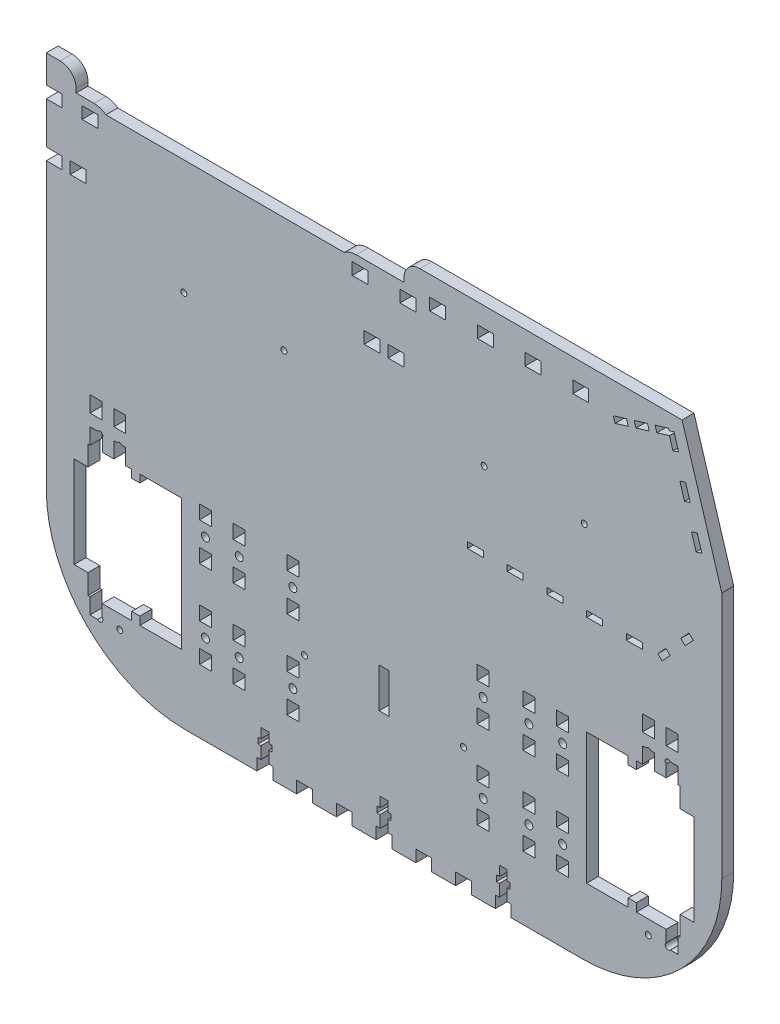
from build123d import *

# Parameters (mm, degrees)
ESQUISSE1_W              = 340
ESQUISSE1_H              = 260
BOSS_EXTRU_1_DEPTH       = 6
ESQUISSE10_R             = 2
ESQUISSE10_W             = 6
ESQUISSE10_H             = 7
ESQUISSE10_W_2           = 5
ESQUISSE10_H_2           = 20
ESQUISSE10_W_3           = 21
ESQUISSE10_H_3           = 66
ENL_V_MAT_EXTRU_5_DEPTH  = 6
ESQUISSE13_R             = 1.5
ENL_V_MAT_EXTRU_6_DEPTH  = 6
CONG_1_R                 = 70
ESQUISSE14_W             = 165
ESQUISSE14_H             = 10
ENL_V_MAT_EXTRU_7_DEPTH  = 10
ESQUISSE15_W             = 120
ESQUISSE15_H             = 2
ENL_V_MAT_EXTRU_8_DEPTH  = 10
CONG_2_R                 = 10
CONG_3_R                 = 8
ESQUISSE16_W             = 8
ESQUISSE16_H             = 6
ENL_V_MAT_EXTRU_9_DEPTH  = 10
ENL_V_MAT_EXTRU_10_DEPTH = 10
ESQUISSE18_W             = 8
ESQUISSE18_H             = 3
ENL_V_MAT_EXTRU_11_DEPTH = 6
ESQUISSE20_W             = 8
ESQUISSE20_H             = 6
ENL_V_MAT_EXTRU_12_DEPTH = 6
ENL_V_MAT_EXTRU_13_DEPTH = 6
ESQUISSE22_W             = 8
ESQUISSE22_H             = 6
ENL_V_MAT_EXTRU_14_DEPTH = 6
ESQUISSE25_W             = 6.118033989
ESQUISSE25_H             = 8
ESQUISSE25_W_2           = 6.235191658
ESQUISSE25_W_3           = 6
ENL_V_MAT_EXTRU_15_DEPTH = 10
ESQUISSE26_W             = 4
ESQUISSE26_H             = 14
ESQUISSE26_W_2           = 7
ESQUISSE26_H_2           = 3
ENL_V_MAT_EXTRU_16_DEPTH = 429.060743353


with BuildPart() as part:
    # Esquisse1 → Boss.-Extru.1 (new body)
    with BuildSketch(Plane.XY):
        with Locations((-170, 130)):
            Rectangle(ESQUISSE1_W, ESQUISSE1_H)
    extrude(amount=-BOSS_EXTRU_1_DEPTH)

    # Esquisse10 → Enlèv. mat.-Extru.5 (cut)
    with BuildSketch(Plane(origin=(0, 0, -6), x_dir=(-1, 0, 0), z_dir=(0, 0, -1))):
        with Locations((259.9, 45)):
            Circle(ESQUISSE10_R)
        with Locations((259.9, 89)):
            Circle(ESQUISSE10_R)
        with Locations((242.9, 45)):
            Circle(ESQUISSE10_R)
        with Locations((242.9, 89)):
            Circle(ESQUISSE10_R)
        with Locations((215.9, 45)):
            Circle(ESQUISSE10_R)
        with Locations((215.9, 89)):
            Circle(ESQUISSE10_R)
        with Locations(Location((97.1, 89, 0), (0, 0, 180))):
            Circle(ESQUISSE10_R)
        with Locations(Location((97.1, 45, 0), (0, 0, 180))):
            Circle(ESQUISSE10_R)
        with Locations(Location((80.1, 89, 0), (0, 0, 180))):
            Circle(ESQUISSE10_R)
        with Locations(Location((120.1, 89, 0), (0, 0, 180))):
            Circle(ESQUISSE10_R)
        with Locations(Location((120.1, 45, 0), (0, 0, 180))):
            Circle(ESQUISSE10_R)
        with Locations(Location((80.1, 45, 0), (0, 0, 180))):
            Circle(ESQUISSE10_R)
        with Locations((259.9, 35.5)):
            Rectangle(ESQUISSE10_W, ESQUISSE10_H)
        with Locations((259.9, 54.5)):
            Rectangle(ESQUISSE10_W, ESQUISSE10_H)
        with Locations((259.9, 79.5)):
            Rectangle(ESQUISSE10_W, ESQUISSE10_H)
        with Locations((259.9, 98.5)):
            Rectangle(ESQUISSE10_W, ESQUISSE10_H)
        with Locations((242.9, 35.5)):
            Rectangle(ESQUISSE10_W, ESQUISSE10_H)
        with Locations((170, 67)):
            Rectangle(ESQUISSE10_W_2, ESQUISSE10_H_2)
        with Locations((242.9, 54.5)):
            Rectangle(ESQUISSE10_W, ESQUISSE10_H)
        with Locations((242.9, 79.5)):
            Rectangle(ESQUISSE10_W, ESQUISSE10_H)
        with Locations((242.9, 98.5)):
            Rectangle(ESQUISSE10_W, ESQUISSE10_H)
        with Locations((215.9, 35.5)):
            Rectangle(ESQUISSE10_W, ESQUISSE10_H)
        with Locations((215.9, 54.5)):
            Rectangle(ESQUISSE10_W, ESQUISSE10_H)
        with Locations((215.9, 79.5)):
            Rectangle(ESQUISSE10_W, ESQUISSE10_H)
        with Locations((215.9, 98.5)):
            Rectangle(ESQUISSE10_W, ESQUISSE10_H)
        with Locations((97.1, 98.5)):
            Rectangle(ESQUISSE10_W, ESQUISSE10_H)
        with Locations((97.1, 79.5)):
            Rectangle(ESQUISSE10_W, ESQUISSE10_H)
        with Locations((97.1, 54.5)):
            Rectangle(ESQUISSE10_W, ESQUISSE10_H)
        with Locations((97.1, 35.5)):
            Rectangle(ESQUISSE10_W, ESQUISSE10_H)
        with Locations((80.1, 98.5)):
            Rectangle(ESQUISSE10_W, ESQUISSE10_H)
        with Locations((80.1, 79.5)):
            Rectangle(ESQUISSE10_W, ESQUISSE10_H)
        with Locations((120.1, 98.5)):
            Rectangle(ESQUISSE10_W, ESQUISSE10_H)
        with Locations((120.1, 79.5)):
            Rectangle(ESQUISSE10_W, ESQUISSE10_H)
        with Locations((80.1, 54.5)):
            Rectangle(ESQUISSE10_W, ESQUISSE10_H)
        with Locations((120.1, 54.5)):
            Rectangle(ESQUISSE10_W, ESQUISSE10_H)
        with Locations((120.1, 35.5)):
            Rectangle(ESQUISSE10_W, ESQUISSE10_H)
        with Locations((80.1, 35.5)):
            Rectangle(ESQUISSE10_W, ESQUISSE10_H)
        with Locations((282.4, 67)):
            Rectangle(ESQUISSE10_W_3, ESQUISSE10_H_3)
        with Locations((57.6, 67)):
            Rectangle(ESQUISSE10_W_3, ESQUISSE10_H_3)
    extrude(amount=-ENL_V_MAT_EXTRU_5_DEPTH, mode=Mode.SUBTRACT)

    # Esquisse13 → Enlèv. mat.-Extru.6 (cut)
    with BuildSketch(Plane(origin=(0, 0, -6), x_dir=(-1, 0, 0), z_dir=(0, 0, -1))):
        with Locations((69.249793531, 190.11516604)):
            Circle(ESQUISSE13_R)
        with Locations((119.624896765, 190.11516604)):
            Circle(ESQUISSE13_R)
        with Locations(Location((220.375103235, 190.11516604, 0), (0, 0, 180))):
            Circle(ESQUISSE13_R)
        with Locations(Location((270.750206469, 190.11516604, 0), (0, 0, 180))):
            Circle(ESQUISSE13_R)
        with Locations((27, 27)):
            Circle(ESQUISSE13_R)
        with Locations((130, 62.4)):
            Circle(ESQUISSE13_R)
        with Locations(Location((210, 62.4, 0), (0, 0, 180))):
            Circle(ESQUISSE13_R)
        with Locations((37, 27)):
            Circle(ESQUISSE13_R)
        with Locations(Location((37, 107.148940914, 0), (0, 0, 180))):
            Circle(ESQUISSE13_R)
        with Locations(Location((27, 107.148940914, 0), (0, 0, 180))):
            Circle(ESQUISSE13_R)
        with Locations(Location((303, 27, 0), (0, 0, 180))):
            Circle(ESQUISSE13_R)
        with Locations(Location((313, 27, 0), (0, 0, 180))):
            Circle(ESQUISSE13_R)
        with Locations((313, 107.148940914)):
            Circle(ESQUISSE13_R)
        with Locations((303, 107.148940914)):
            Circle(ESQUISSE13_R)
        Polygon((43, 100), (21, 100), (21, 90), (14, 90), (14, 44), (21, 44), (21, 34), (43, 34), (43, 38.074470457), (47.1, 38.074470457), (47.1, 96.074470457), (43, 96.074470457), align=None)
        Polygon((297, 38.074470457), (297, 34), (319, 34), (319, 44), (326, 44), (326, 90), (319, 90), (319, 100), (297, 100), (297, 96.074470457), (292.9, 96.074470457), (292.9, 38.074470457), align=None)
    extrude(amount=-ENL_V_MAT_EXTRU_6_DEPTH, mode=Mode.SUBTRACT)

    # Congé1
    cong_1_edges = [part.edges().sort_by_distance(p)[0] for p in [
        (0, 0, -3),
        (-340, 0, -3),
    ]]
    fillet(cong_1_edges, radius=CONG_1_R)

    # Esquisse14 → Enlèv. mat.-Extru.7 (cut)
    with BuildSketch(Plane(origin=(0, 0, -6), x_dir=(-1, 0, 0), z_dir=(0, 0, -1))):
        with Locations((242.5, 255)):
            Rectangle(ESQUISSE14_W, ESQUISSE14_H)
    extrude(amount=-ENL_V_MAT_EXTRU_7_DEPTH, mode=Mode.SUBTRACT)

    # Esquisse15 → Enlèv. mat.-Extru.8 (cut)
    with BuildSketch(Plane.XY):
        with Locations((-250, 249)):
            Rectangle(ESQUISSE15_W, ESQUISSE15_H)
    extrude(amount=-ENL_V_MAT_EXTRU_8_DEPTH, mode=Mode.SUBTRACT)

    # Congé2
    # the kernel refuses this fillet: 10 mm, written as the material it takes off along each edge
    with BuildSketch(Plane(origin=(-190, 250, 15), x_dir=(1, 0, 0), z_dir=(0, 0, -1))) as cong_2_piece_1:
        with BuildLine():
            CenterArc((6, 10), CONG_2_R, 233.130102354, 36.869897646)
            Line((0, 2), (-0.12, 1.84))
            ThreePointArc((-0.12, 1.84), (-0.2, 1), (-0.2, 0))
            Line((-0.2, 0), (0, -0.2))
            Line((0, -0.2), (6, -0.2))
            Line((6, -0.2), (6, 0))
        make_face()
    extrude(amount=36, mode=Mode.SUBTRACT)
    with BuildSketch(Plane(origin=(-310, 250, 15), x_dir=(0, -1, 0), z_dir=(0, 0, -1))) as cong_2_piece_2:
        with BuildLine():
            CenterArc((10, 6), CONG_2_R, 180, 36.869897646)
            Line((0, 6), (-0.2, 6))
            Line((-0.2, 6), (-0.2, 0))
            Line((-0.2, 0), (0, -0.2))
            ThreePointArc((0, -0.2), (1, -0.2), (1.84, -0.12))
            Line((1.84, -0.12), (2, 0))
        make_face()
    extrude(amount=36, mode=Mode.SUBTRACT)

    # Congé3
    cong_3_edges = [part.edges().sort_by_distance(p)[0] for p in [
        (-160, 260, -3),
        (-325, 260, -3),
    ]]
    fillet(cong_3_edges, radius=CONG_3_R)

    # Esquisse16 → Enlèv. mat.-Extru.9 (cut)
    with BuildSketch(Plane.XY):
        with Locations((-110, 3)):
            Rectangle(ESQUISSE16_W, ESQUISSE16_H)
        with Locations((-130, 3)):
            Rectangle(ESQUISSE16_W, ESQUISSE16_H)
        with Locations((-150, 3)):
            Rectangle(ESQUISSE16_W, ESQUISSE16_H)
        with Locations((-170, 3)):
            Rectangle(ESQUISSE16_W, ESQUISSE16_H)
        with Locations((-190, 3)):
            Rectangle(ESQUISSE16_W, ESQUISSE16_H)
        with Locations((-210, 3)):
            Rectangle(ESQUISSE16_W, ESQUISSE16_H)
        with Locations((-230, 3)):
            Rectangle(ESQUISSE16_W, ESQUISSE16_H)
    extrude(amount=-ENL_V_MAT_EXTRU_9_DEPTH, mode=Mode.SUBTRACT)

    # Esquisse17 → Enlèv. mat.-Extru.10 (cut)
    with BuildSketch(Plane.XY):
        Polygon((0, 260), (-20, 260), (-18.336052348, 254.557472466), (-15.997078711, 246.907034419), (-12.488618254, 235.431377347), (-10.149644616, 227.7809393), (-6.641184159, 216.305282228), (-4.302210522, 208.65484418), (0, 194.58294763), align=None)
        Polygon((-12.908953325, 206.023498838), (-10.040039057, 206.900613952), (-12.379012695, 214.551052), (-15.247926963, 213.673936885), align=None)
        Polygon((-15.887473152, 226.026709071), (-18.22644679, 233.677147119), (-21.095361058, 232.800032005), (-18.75638742, 225.149593957), align=None)
        Polygon((-21.734907246, 245.15280419), (-24.073880884, 252.803242238), (-26.942795152, 251.926127124), (-24.603821514, 244.275689076), align=None)
    extrude(amount=-ENL_V_MAT_EXTRU_10_DEPTH, mode=Mode.SUBTRACT)

    # Esquisse18 → Enlèv. mat.-Extru.11 (cut)
    with BuildSketch(Plane(origin=(0, 0, -6), x_dir=(-1, 0, 0), z_dir=(0, 0, -1))):
        Polygon((14.345111525, 166.78781256), (16.53917263, 168.83380764), (20.63116279, 164.44568543), (18.437101685, 162.39969035), align=None)
        Polygon((25.939083646, 154.354799632), (28.133144751, 156.400794713), (32.225134911, 152.012672503), (30.031073806, 149.966677423), align=None)
        with Locations((44, 151.5)):
            Rectangle(ESQUISSE18_W, ESQUISSE18_H)
        with Locations((64, 151.5)):
            Rectangle(ESQUISSE18_W, ESQUISSE18_H)
        with Locations((124, 151.5)):
            Rectangle(ESQUISSE18_W, ESQUISSE18_H)
        with Locations((104, 151.5)):
            Rectangle(ESQUISSE18_W, ESQUISSE18_H)
        with Locations((84, 151.5)):
            Rectangle(ESQUISSE18_W, ESQUISSE18_H)
    extrude(amount=-ENL_V_MAT_EXTRU_11_DEPTH, mode=Mode.SUBTRACT)

    # Esquisse20 → Enlèv. mat.-Extru.12 (cut)
    with BuildSketch(Plane(origin=(0, 0, -6), x_dir=(-1, 0, 0), z_dir=(0, 0, -1))):
        with Locations((71, 247)):
            Rectangle(ESQUISSE20_W, ESQUISSE20_H)
        with Locations((95, 247)):
            Rectangle(ESQUISSE20_W, ESQUISSE20_H)
        with Locations((119, 247)):
            Rectangle(ESQUISSE20_W, ESQUISSE20_H)
        with Locations((143, 247)):
            Rectangle(ESQUISSE20_W, ESQUISSE20_H)
    extrude(amount=-ENL_V_MAT_EXTRU_12_DEPTH, mode=Mode.SUBTRACT)

    # Esquisse21 → Enlèv. mat.-Extru.13 (cut)
    with BuildSketch(Plane(origin=(0, 0, -6), x_dir=(-1, 0, 0), z_dir=(0, 0, -1))):
        Polygon((32.69009654, 248.074161064), (33.567211654, 250.943075332), (26.873078363, 252.989677265), (25.995963248, 250.120762997), align=None)
        Polygon((36.515315564, 246.904674245), (37.392430678, 249.773588513), (44.08656397, 247.72698658), (43.209448856, 244.858072312), align=None)
        Polygon((47.911782994, 246.557499761), (47.03466788, 243.688585493), (53.728801171, 241.64198356), (54.605916286, 244.510897828), align=None)
    extrude(amount=-ENL_V_MAT_EXTRU_13_DEPTH, mode=Mode.SUBTRACT)

    # Esquisse22 → Enlèv. mat.-Extru.14 (cut)
    with BuildSketch(Plane(origin=(0, 0, -6), x_dir=(-1, 0, 0), z_dir=(0, 0, -1))):
        with Locations((336, 243)):
            Rectangle(ESQUISSE22_W, ESQUISSE22_H)
        with Locations((318, 243)):
            Rectangle(ESQUISSE22_W, ESQUISSE22_H)
        with Locations((324, 216)):
            Rectangle(ESQUISSE22_W, ESQUISSE22_H)
        with Locations((336, 216)):
            Rectangle(ESQUISSE22_W, ESQUISSE22_H)
        with Locations((158, 243)):
            Rectangle(ESQUISSE22_W, ESQUISSE22_H)
        with Locations((182, 243)):
            Rectangle(ESQUISSE22_W, ESQUISSE22_H)
        with Locations((164, 216)):
            Rectangle(ESQUISSE22_W, ESQUISSE22_H)
        with Locations((176, 216)):
            Rectangle(ESQUISSE22_W, ESQUISSE22_H)
    extrude(amount=-ENL_V_MAT_EXTRU_14_DEPTH, mode=Mode.SUBTRACT)

    # Esquisse25 → Enlèv. mat.-Extru.15 (cut)
    with BuildSketch(Plane(origin=(0, 0, -6), x_dir=(-1, 0, 0), z_dir=(0, 0, -1))):
        with Locations((314.940983006, 30)):
            Rectangle(ESQUISSE25_W, ESQUISSE25_H)
        with Locations((314.882404171, 104)):
            Rectangle(ESQUISSE25_W_2, ESQUISSE25_H)
        with Locations((315, 118)):
            Rectangle(ESQUISSE25_W_3, ESQUISSE25_H)
        with Locations((37, 118)):
            Rectangle(ESQUISSE25_W_3, ESQUISSE25_H)
        with Locations((25, 118)):
            Rectangle(ESQUISSE25_W_3, ESQUISSE25_H)
        with Locations((25, 104)):
            Rectangle(ESQUISSE25_W_3, ESQUISSE25_H)
        with Locations((37, 104)):
            Rectangle(ESQUISSE25_W_3, ESQUISSE25_H)
        with Locations((25, 30)):
            Rectangle(ESQUISSE25_W_3, ESQUISSE25_H)
        with Locations((303, 104)):
            Rectangle(ESQUISSE25_W_3, ESQUISSE25_H)
        with Locations((303, 118)):
            Rectangle(ESQUISSE25_W_3, ESQUISSE25_H)
    extrude(amount=-ENL_V_MAT_EXTRU_15_DEPTH, mode=Mode.SUBTRACT)

    # Esquisse26 → Enlèv. mat.-Extru.16 (cut, through all)
    with BuildSketch(Plane(origin=(0, 0, -6), x_dir=(-1, 0, 0), z_dir=(0, 0, -1))):
        with Locations((170, 13)):
            Rectangle(ESQUISSE26_W, ESQUISSE26_H)
        with Locations((170, 13.5)):
            Rectangle(ESQUISSE26_W_2, ESQUISSE26_H_2)
        with Locations((110, 13)):
            Rectangle(ESQUISSE26_W, ESQUISSE26_H)
        with Locations((110, 13.5)):
            Rectangle(ESQUISSE26_W_2, ESQUISSE26_H_2)
        with Locations((230, 13)):
            Rectangle(ESQUISSE26_W, ESQUISSE26_H)
        with Locations((230, 13.5)):
            Rectangle(ESQUISSE26_W_2, ESQUISSE26_H_2)
    extrude(amount=-ENL_V_MAT_EXTRU_16_DEPTH, mode=Mode.SUBTRACT)


solid = part.part
